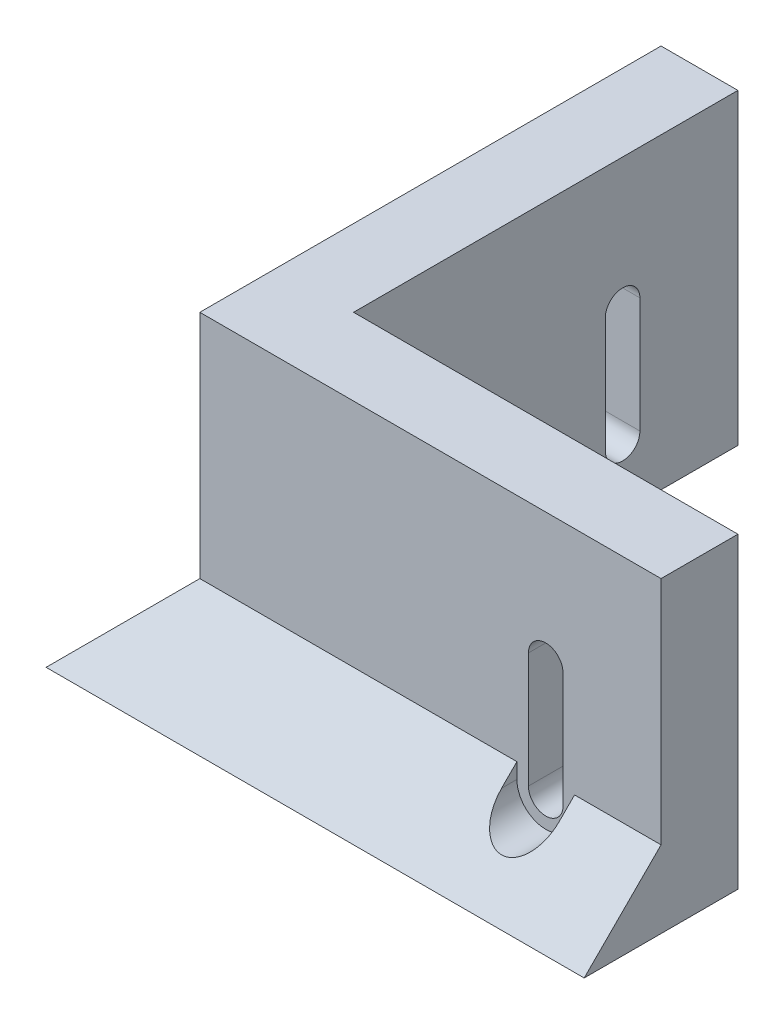
from build123d import *

# Parameters (mm, degrees)
BOSS_EXTRUDE1_DEPTH = 40
BOSS_EXTRUDE2_DEPTH = 15
DRAFT1_START        = -20
DRAFT1_DEPTH        = 70
DRAFT1_START_2      = -50
DRAFT1_2_DEPTH      = 71
CUT_EXTRUDE1_DEPTH  = 88.749643874
CUT_EXTRUDE3_DEPTH  = 88.749643874


with BuildPart() as part:
    # Sketch1 → Boss-Extrude1 (new body)
    with BuildSketch(Plane(origin=(0, 0, 0), x_dir=(1, 0, 0), z_dir=(0, 1, 0))):
        Polygon((0, 0), (0, 50), (-10, 50), (-10, -10), (50, -10), (50, 0), align=None)
    extrude(amount=BOSS_EXTRUDE1_DEPTH)

    # Sketch2 → Boss-Extrude2 (add)
    with BuildSketch(Plane.XZ):
        Polygon((50, 20), (50, 10), (-10, 10), (-10, -50), (-20, -50), (-20, 20), align=None)
    extrude(amount=-BOSS_EXTRUDE2_DEPTH)

    # Draft1: read off the stored shape, not the designer's step
    # Draft1 outline → Draft1 (cut)
    with BuildSketch(Plane.YZ.offset(DRAFT1_START)):
        Polygon((0, 20), (10, 10), (15, 10), (15, 20), align=None)
    extrude(amount=DRAFT1_DEPTH, mode=Mode.SUBTRACT)

    # Draft1 2 outline → Draft1 2 (cut)
    with BuildSketch(Plane.XY.offset(DRAFT1_START_2)):
        Polygon((-20, 0), (-10, 10), (-10, 15), (-20, 15), align=None)
    extrude(amount=DRAFT1_2_DEPTH, mode=Mode.SUBTRACT)

    # Sketch3 → Cut-Extrude1 (cut, through all)
    with BuildSketch(Plane.XY.offset(10)):
        with BuildLine():
            Line((37.25, 23), (37.25, 8))
            ThreePointArc((37.25, 8), (35, 5.75), (32.75, 8))
            Line((32.75, 8), (32.75, 23))
            ThreePointArc((32.75, 23), (35, 25.25), (37.25, 23))
        make_face()
    cut_extrude1 = extrude(amount=-CUT_EXTRUDE1_DEPTH, mode=Mode.SUBTRACT)

    # Sketch4 → Cut-Extrude3 (cut, through all)
    with BuildSketch(Plane.XY.offset(10)):
        with BuildLine():
            Line((38.75, 8), (38.75, 23))
            ThreePointArc((38.75, 23), (35, 26.75), (31.25, 23))
            Line((31.25, 23), (31.25, 8))
            ThreePointArc((31.25, 8), (35, 4.25), (38.75, 8))
        make_face()
    cut_extrude3 = extrude(amount=CUT_EXTRUDE3_DEPTH, mode=Mode.SUBTRACT)

    # Mirror1: Cut-Extrude1, Cut-Extrude3 across plane
    add(cut_extrude1.mirror(Plane(origin=(0, 0, 0), x_dir=(-0.7071067811865476, 0, 0.7071067811865476), z_dir=(-0.7071067811865477, 0, -0.7071067811865475))), mode=Mode.SUBTRACT)
    add(cut_extrude3.mirror(Plane(origin=(0, 0, 0), x_dir=(-0.7071067811865476, 0, 0.7071067811865476), z_dir=(-0.7071067811865477, 0, -0.7071067811865475))), mode=Mode.SUBTRACT)


solid = part.part
